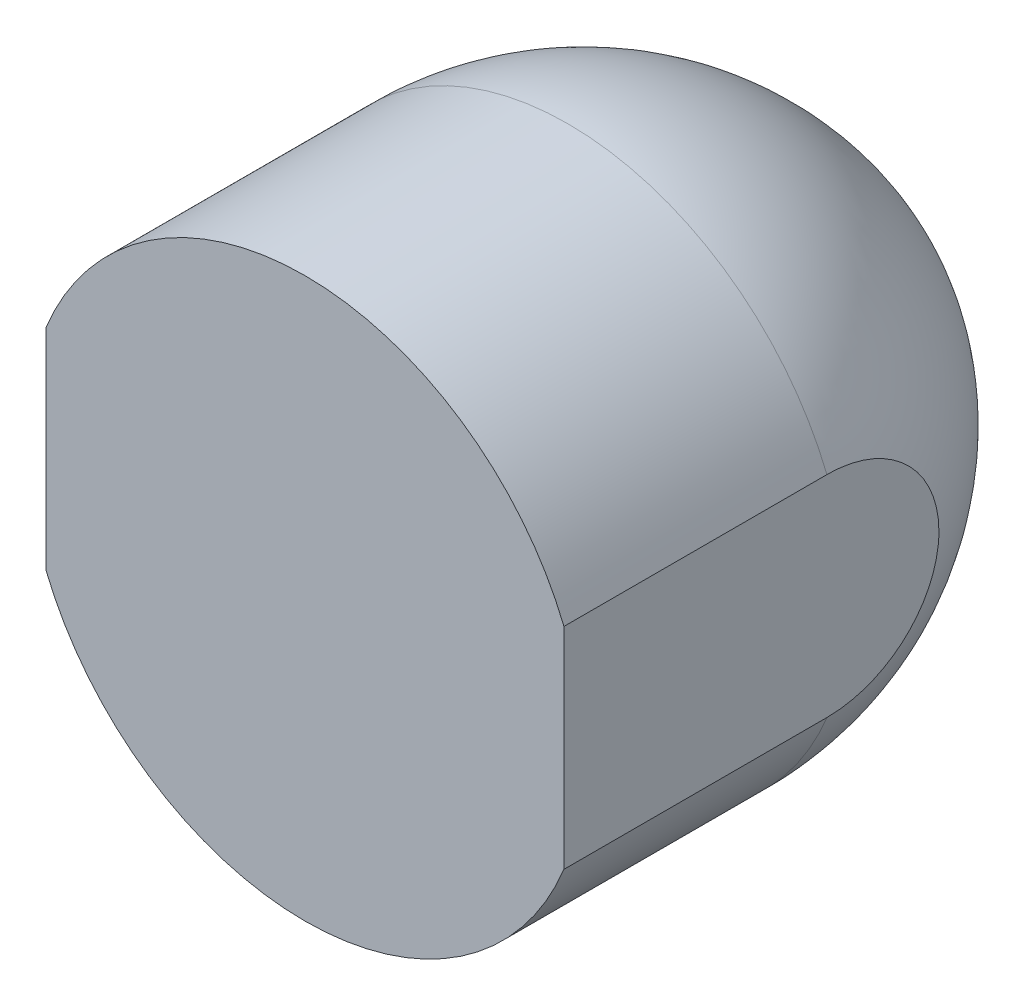
from build123d import *

# Parameters (mm, degrees)
CUT_EXTRUDE2_DEPTH      = 14.290482533
CUT_EXTRUDE2_DEPTH_BACK = 14.290482533
CUT_EXTRUDE4_DEPTH      = 14.290482533
CUT_EXTRUDE4_DEPTH_BACK = 14.290482533


with BuildPart() as part:
    # Sketch1 → Revolve2 (revolve)
    with BuildSketch(Plane(origin=(0, 0, 0), x_dir=(1, 0, 0), z_dir=(0, 1, 0))):
        with BuildLine():
            Line((0, 0), (5.315, 0))
            Line((5.315, 0), (5.315, 5))
            ThreePointArc((5.315, 5), (3.79328092, 8.993119082), (0, 10.960769665))
            Line((0, 10.960769665), (0, 0))
        make_face()
    revolve(axis=Axis((0, 0, 0), (0, 0, -1)))

    # Sketch3 → Cut-Extrude2 (cut, two sides: drawn at the far end of the back side and taken through both)
    with BuildSketch(Plane.XY.offset(-CUT_EXTRUDE2_DEPTH_BACK)):
        Polygon((-4.924350211, -37.167719106), (-4.924350211, -2), (-4.924350211, 2), (-4.924350211, 37.167719106), (-75.259788424, 37.167719106), (-75.259788424, -37.167719106), align=None)
    extrude(amount=CUT_EXTRUDE2_DEPTH + CUT_EXTRUDE2_DEPTH_BACK, mode=Mode.SUBTRACT)

    # Sketch4 → Cut-Extrude4 (cut, two sides: drawn at the far end of the back side and taken through both)
    with BuildSketch(Plane.XY.offset(-CUT_EXTRUDE4_DEPTH_BACK)):
        Polygon((4.924350211, -37.167719106), (4.924350211, -2), (4.924350211, 2), (4.924350211, 37.167719106), (75.259788424, 37.167719106), (75.259788424, -37.167719106), align=None)
    extrude(amount=CUT_EXTRUDE4_DEPTH + CUT_EXTRUDE4_DEPTH_BACK, mode=Mode.SUBTRACT)


solid = part.part
